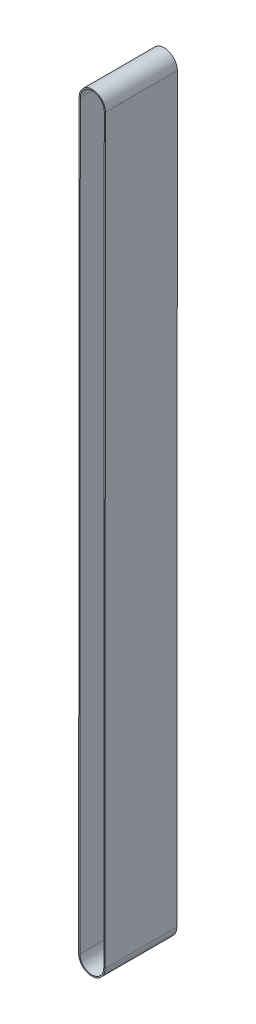
from build123d import *

# Parameters (mm, degrees)
EXTRUDE_THIN3_DEPTH   = 300
EXTRUDE_THIN3_2_DEPTH = 300


with BuildPart() as part:
    # Sketch1 → Extrude-Thin3 (new, symmetric)
    with BuildSketch(Plane.XY):
        with BuildLine():
            ThreePointArc((103.999916485, 3109.886387112), (4.064620179, 3210.015606563), (-96, 3110.015627442))
            Line((-96, 3110.015627442), (-100, -3080))
            Line((-100, -3080), (-109.999997912, -3079.993537982))
            Line((-109.999997912, -3079.993537982), (-105.99999995, 3110.018935429))
            ThreePointArc((-105.99999995, 3110.018935429), (4.072736189, 3220.015603394), (113.999908133, 3109.873463079))
            Line((113.999908133, 3109.873463079), (103.999916485, 3109.886387112))
        make_face()
    extrude(amount=EXTRUDE_THIN3_DEPTH, both=True)


with BuildPart() as body_2:
    # Sketch1 → Extrude-Thin3 2 (new, symmetric)
    with BuildSketch(Plane.XY):
        with BuildLine():
            ThreePointArc((-99.999916485, -3079.870759669), (-0.064620179, -3179.999979121), (100, -3080))
            Line((100, -3080), (104, 3110.015627442))
            Line((104, 3110.015627442), (113.999997912, 3110.009165424))
            Line((113.999997912, 3110.009165424), (109.99999995, -3080.003307982))
            ThreePointArc((109.99999995, -3080.003307982), (-0.072736187, -3189.999975952), (-109.999908133, -3079.857835636))
            Line((-109.999908133, -3079.857835636), (-99.999916485, -3079.870759669))
        make_face()
    extrude(amount=EXTRUDE_THIN3_2_DEPTH, both=True)


solid = Compound([part.part, body_2.part])
